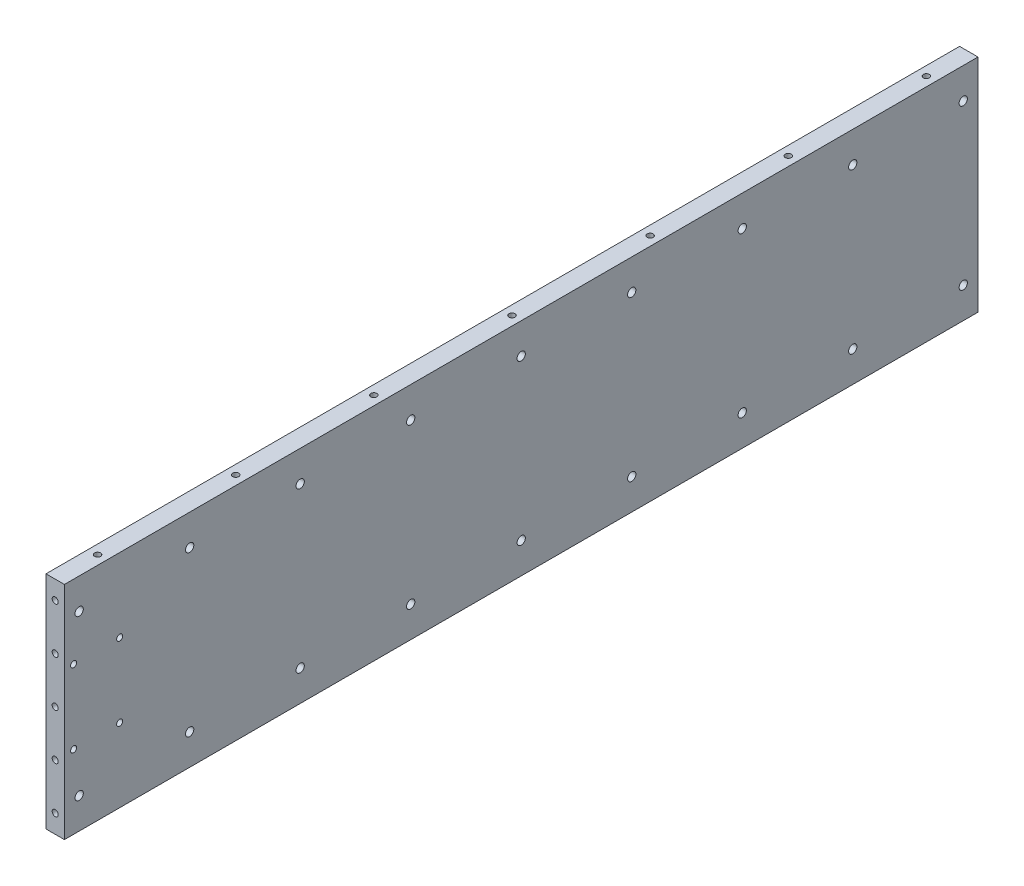
from build123d import *

# Parameters (mm, degrees)
SKETCH2_W                  = 10
SKETCH2_H                  = 120
BOSS_EXTRUDE1_DEPTH        = 496
M4_TAPPED_HOLE1_D          = 3.3
M4_TAPPED_HOLE1_DEPTH      = 14.1
M4_TAPPED_HOLE1_TIP        = 0.991420021
M4_TAPPED_HOLE2_D          = 3.3
M4_TAPPED_HOLE2_DEPTH      = 14.1
M4_TAPPED_HOLE2_TIP        = 0.991420021
F_4_5_4_5_DIAMETER_HOLE1_D = 4.5
M4_TAPPED_HOLE3_D          = 3.3
M4_TAPPED_HOLE4_D          = 3.3
M4_TAPPED_HOLE4_DEPTH      = 15.1
M4_TAPPED_HOLE4_TIP        = 0.991420021


with BuildPart() as part:
    # Sketch2 → Boss-Extrude1 (new body)
    with BuildSketch(Plane.XY):
        with Locations((-5, -60)):
            Rectangle(SKETCH2_W, SKETCH2_H)
    extrude(amount=BOSS_EXTRUDE1_DEPTH)

    # M4 Tapped Hole1
    with Locations(Plane(origin=(-5, -10, 496), x_dir=(1, 0, 0), z_dir=(0, 0, 1))):
        with Locations((0, 0), (0, -25), (0, -50), (0, -75), (0, -100)):
            Hole(M4_TAPPED_HOLE1_D / 2, depth=M4_TAPPED_HOLE1_DEPTH)
            with Locations((0, 0, -(M4_TAPPED_HOLE1_DEPTH + M4_TAPPED_HOLE1_TIP / 2))):  # 118° drill point
                Cone(0, M4_TAPPED_HOLE1_D / 2, M4_TAPPED_HOLE1_TIP, mode=Mode.SUBTRACT)

    # M4 Tapped Hole2
    with Locations(Plane(origin=(-5, -10, 0), x_dir=(-1, 0, 0), z_dir=(0, 0, -1))):
        with Locations((0, 0), (0, -25), (0, -50), (0, -75), (0, -100)):
            Hole(M4_TAPPED_HOLE2_D / 2, depth=M4_TAPPED_HOLE2_DEPTH)
            with Locations((0, 0, -(M4_TAPPED_HOLE2_DEPTH + M4_TAPPED_HOLE2_TIP / 2))):  # 118° drill point
                Cone(0, M4_TAPPED_HOLE2_D / 2, M4_TAPPED_HOLE2_TIP, mode=Mode.SUBTRACT)

    # Ø4.5 (4.5) Diameter Hole1 (through all)
    with Locations(Plane(origin=(0, -16.7, 488), x_dir=(0, 0, 1), z_dir=(1, 0, 0))):
        with Locations((0, 0), (-60, 0), (-120, 0), (-180, 0), (-240, 0), (-300, 0), (-360, 0), (-420, 0), (-480, 0), (-480, 86.6), (-420, 86.6), (-360, 86.6), (-300, 86.6), (-240, 86.6), (-180, 86.6), (-120, 86.6), (-60, 86.6), (0, 86.6)):
            Hole(F_4_5_4_5_DIAMETER_HOLE1_D / 2)

    # M4 Tapped Hole3 (through all)
    with Locations(Plane(origin=(0, -40, 491), x_dir=(0, 0, 1), z_dir=(1, 0, 0))):
        with Locations((0, 0), (-25, 0), (0, 40), (-25, 40)):
            Hole(M4_TAPPED_HOLE3_D / 2)

    # M4 Tapped Hole4
    with Locations(Plane(origin=(-5, 5, 23), x_dir=(0, 0, 1), z_dir=(0, 1, 0))):
        with Locations((0, 0), (75, 0), (150, 0), (225, 0), (300, 0), (375, 0), (450, 0)):
            Hole(M4_TAPPED_HOLE4_D / 2, depth=M4_TAPPED_HOLE4_DEPTH)
            with Locations((0, 0, -(M4_TAPPED_HOLE4_DEPTH + M4_TAPPED_HOLE4_TIP / 2))):  # 118° drill point
                Cone(0, M4_TAPPED_HOLE4_D / 2, M4_TAPPED_HOLE4_TIP, mode=Mode.SUBTRACT)


solid = part.part
